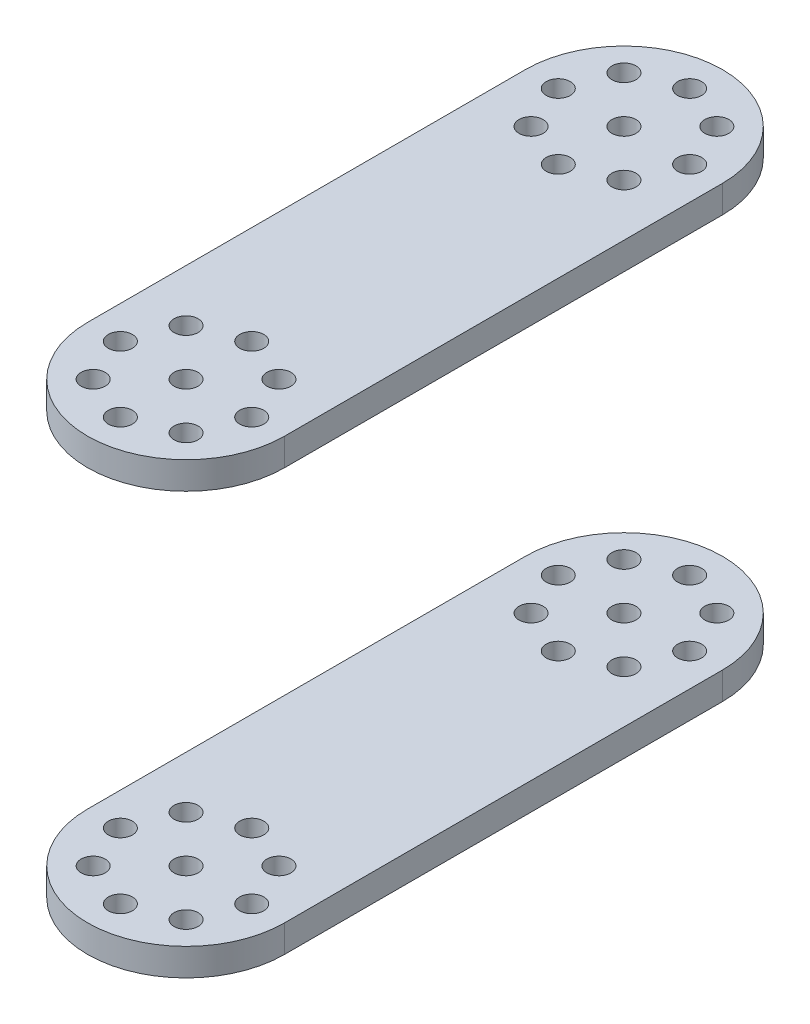
from build123d import *

# Parameters (mm, degrees)
SKETCH_1_R      = 1.1
EXTRUDE_1_DEPTH = 2.5
SKETCH_2_R      = 1.1
EXTRUDE_2_DEPTH = 2.5


with BuildPart() as part:
    # ｽｹｯﾁ1 → ﾎﾞｽ - 押し出し1 (new body)
    with BuildSketch(Plane(origin=(0, 0, 0), x_dir=(1, 0, 0), z_dir=(0, 1, 0))):
        with BuildLine():
            Line((-9, 40), (-9, 0))
            ThreePointArc((-9, 0), (0, -9), (9, 0))
            Line((9, 0), (9, 40))
            ThreePointArc((9, 40), (0, 49), (-9, 40))
        make_face()
        with Locations((0, 46)):
            Circle(SKETCH_1_R, mode=Mode.SUBTRACT)
        with Locations((4.242640687, 44.242640687)):
            Circle(SKETCH_1_R, mode=Mode.SUBTRACT)
        with Locations((6, 40)):
            Circle(SKETCH_1_R, mode=Mode.SUBTRACT)
        with Locations((4.242640687, 35.757359313)):
            Circle(SKETCH_1_R, mode=Mode.SUBTRACT)
        with Locations((0, 34)):
            Circle(SKETCH_1_R, mode=Mode.SUBTRACT)
        with Locations((-4.242640687, 35.757359313)):
            Circle(SKETCH_1_R, mode=Mode.SUBTRACT)
        with Locations((-6, 40)):
            Circle(SKETCH_1_R, mode=Mode.SUBTRACT)
        with Locations((-4.242640687, 44.242640687)):
            Circle(SKETCH_1_R, mode=Mode.SUBTRACT)
        with Locations((0, 40)):
            Circle(SKETCH_1_R, mode=Mode.SUBTRACT)
        Circle(SKETCH_1_R, mode=Mode.SUBTRACT)
        with Locations((0, 6)):
            Circle(SKETCH_1_R, mode=Mode.SUBTRACT)
        with Locations((4.242640687, 4.242640687)):
            Circle(SKETCH_1_R, mode=Mode.SUBTRACT)
        with Locations((6, 0)):
            Circle(SKETCH_1_R, mode=Mode.SUBTRACT)
        with Locations((4.242640687, -4.242640687)):
            Circle(SKETCH_1_R, mode=Mode.SUBTRACT)
        with Locations((0, -6)):
            Circle(SKETCH_1_R, mode=Mode.SUBTRACT)
        with Locations((-4.242640687, -4.242640687)):
            Circle(SKETCH_1_R, mode=Mode.SUBTRACT)
        with Locations((-6, 0)):
            Circle(SKETCH_1_R, mode=Mode.SUBTRACT)
        with Locations((-4.242640687, 4.242640687)):
            Circle(SKETCH_1_R, mode=Mode.SUBTRACT)
    extrude(amount=EXTRUDE_1_DEPTH)


with BuildPart() as body_2:
    # ｽｹｯﾁ2 → ﾎﾞｽ - 押し出し2 (new body)
    with BuildSketch(Plane(origin=(0, -36, 0), x_dir=(1, 0, 0), z_dir=(0, 1, 0))):
        with BuildLine():
            Line((9, 0), (9, 40))
            ThreePointArc((9, 40), (0, 49), (-9, 40))
            Line((-9, 40), (-9, 0))
            ThreePointArc((-9, 0), (0, -9), (9, 0))
        make_face()
        with Locations((0, 40)):
            Circle(SKETCH_2_R, mode=Mode.SUBTRACT)
        with Locations((0, 46)):
            Circle(SKETCH_2_R, mode=Mode.SUBTRACT)
        with Locations((4.242640687, 44.242640687)):
            Circle(SKETCH_2_R, mode=Mode.SUBTRACT)
        with Locations((6, 40)):
            Circle(SKETCH_2_R, mode=Mode.SUBTRACT)
        Circle(SKETCH_2_R, mode=Mode.SUBTRACT)
        with Locations((0, 6)):
            Circle(SKETCH_2_R, mode=Mode.SUBTRACT)
        with Locations((4.242640687, 4.242640687)):
            Circle(SKETCH_2_R, mode=Mode.SUBTRACT)
        with Locations((6, 0)):
            Circle(SKETCH_2_R, mode=Mode.SUBTRACT)
        with Locations((4.242640687, -4.242640687)):
            Circle(SKETCH_2_R, mode=Mode.SUBTRACT)
        with Locations((0, -6)):
            Circle(SKETCH_2_R, mode=Mode.SUBTRACT)
        with Locations((-4.242640687, -4.242640687)):
            Circle(SKETCH_2_R, mode=Mode.SUBTRACT)
        with Locations((-6, 0)):
            Circle(SKETCH_2_R, mode=Mode.SUBTRACT)
        with Locations((-4.242640687, 4.242640687)):
            Circle(SKETCH_2_R, mode=Mode.SUBTRACT)
        with Locations((4.242640687, 35.757359313)):
            Circle(SKETCH_2_R, mode=Mode.SUBTRACT)
        with Locations((0, 34)):
            Circle(SKETCH_2_R, mode=Mode.SUBTRACT)
        with Locations((-4.242640687, 35.757359313)):
            Circle(SKETCH_2_R, mode=Mode.SUBTRACT)
        with Locations((-6, 40)):
            Circle(SKETCH_2_R, mode=Mode.SUBTRACT)
        with Locations((-4.242640687, 44.242640687)):
            Circle(SKETCH_2_R, mode=Mode.SUBTRACT)
    extrude(amount=-EXTRUDE_2_DEPTH)


solid = Compound([part.part, body_2.part])
